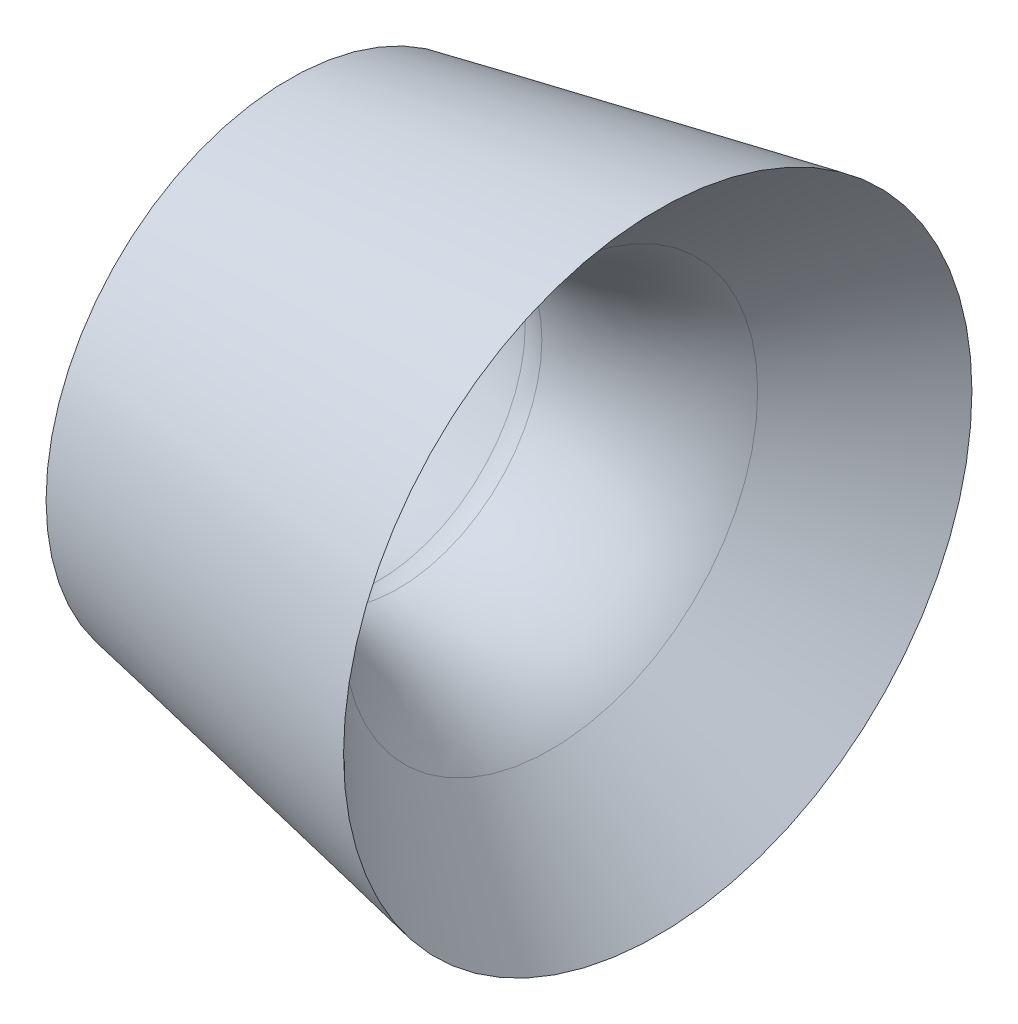
from build123d import *


with BuildPart() as part:
    # Sketch1 → Revolve1 (revolve)
    with BuildSketch(Plane.XY):
        with BuildLine():
            Line((-8.342554344, 16.129458016), (0, 24.47201236))
            Line((0, 24.47201236), (-28.701365604, 18.941189381))
            Line((-28.701365604, 18.941189381), (-28.701365604, 14.20615))
            ThreePointArc((-28.701365604, 14.20615), (-25.262342288, 12.886529827), (-21.841084334, 11.521512325))
            ThreePointArc((-21.841084334, 11.521512325), (-21.050051224, 11.285730291), (-20.228471328, 11.20615))
            ThreePointArc((-20.228471328, 11.20615), (-13.795859409, 12.485676065), (-8.342554344, 16.129458016))
        make_face()
    revolve(axis=Axis((0, 0, 0), (-1, 0, 0)))


solid = part.part
